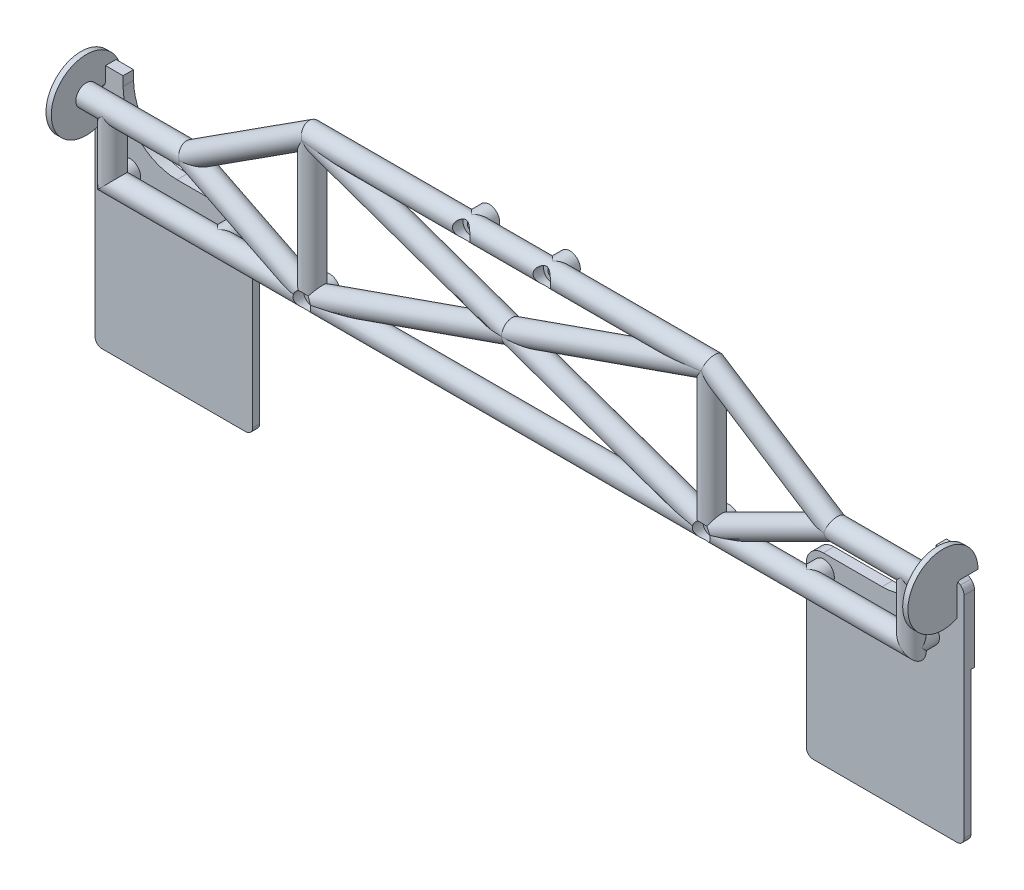
from build123d import *

# Parameters (mm, degrees)
SWEEP1_PROFILE_R    = 3
SWEEP6_PROFILE_R    = 3
SWEEP7_PROFILE_R    = 3
SWEEP8_PROFILE_R    = 3
SWEEP9_PROFILE_R    = 3
SWEEP10_PROFILE_R   = 3
SWEEP11_PROFILE_R   = 3
SKETCH182_R         = 3
BOSS_EXTRUDE1_DEPTH = 5
SKETCH183_R         = 2.5
CUT_EXTRUDE1_DEPTH  = 5
SKETCH184_R         = 1.25
CUT_EXTRUDE2_DEPTH  = 124.91630281
BOSS_EXTRUDE2_DEPTH = 1.5
BOSS_EXTRUDE3_DEPTH = 3
CUT_EXTRUDE3_START  = -1
CUT_EXTRUDE3_DEPTH  = 1


with BuildPart() as part:
    # Sweep1: sweep along a path in Sketch1
    with BuildLine(Plane.XY) as sweep1_path:
        Line((121.5, -2.5), (92, -2.5))
        Line((92, -2.5), (57, 20))
        Line((57, 20), (-57, 20))
        Line((-57, 20), (-92, -2.5))
        Line((-92, -2.5), (-121.5, -2.5))
    # Sweep1 profile (on start of the path) → Sweep1 (sweep)
    with BuildSketch(Plane(origin=(121.5, -2.5, 0), x_dir=(0, -1, 0), z_dir=(-1, 0, 0))):
        Circle(SWEEP1_PROFILE_R)
    sweep(path=sweep1_path.line, transition=Transition.RIGHT)

    # Sweep6: sweep along a path in Sketch108
    with BuildLine(Plane.XY) as sweep6_path:
        Line((-121.5, -2.5), (-92, -2.5))
        Line((-92, -2.5), (-57, -20))
        Line((-57, -20), (57, -20))
        Line((57, -20), (92, -2.5))
        Line((92, -2.5), (121.5, -2.5))
    # Sweep6 profile (on start of the path) → Sweep6 (sweep)
    with BuildSketch(Plane(origin=(-121.5, -2.5, 0), x_dir=(0, 1, 0), z_dir=(1, 0, 0))):
        Circle(SWEEP6_PROFILE_R)
    sweep(path=sweep6_path.line, transition=Transition.RIGHT)

    # Sweep7: sweep along a path in Sketch121
    with BuildLine(Plane.XY) as sweep7_path:
        Line((-57, 20), (57, -20))
    # Sweep7 profile (on start of the path) → Sweep7 (sweep)
    with BuildSketch(Plane(origin=(-57, 20, 0), x_dir=(0.33108771302908074, 0.943599982132881, 0), z_dir=(0.943599982132881, -0.33108771302908074, 0))):
        Circle(SWEEP7_PROFILE_R)
    sweep(path=sweep7_path.line)

    # Sweep8: sweep along a path in Sketch130
    with BuildLine(Plane.XY) as sweep8_path:
        Line((-57, -20), (57, 20))
    # Sweep8 profile (on start of the path) → Sweep8 (sweep)
    with BuildSketch(Plane(origin=(-57, -20, 0), x_dir=(-0.33108771302908074, 0.943599982132881, 0), z_dir=(0.943599982132881, 0.33108771302908074, 0))):
        Circle(SWEEP8_PROFILE_R)
    sweep(path=sweep8_path.line)

    # Sweep9: sweep along a path in Sketch143
    with BuildLine(Plane.XY) as sweep9_path:
        Line((-57, 20), (-57, -20))
    # Sweep9 profile (on start of the path) → Sweep9 (sweep)
    with BuildSketch(Plane(origin=(-57, 20, 0), x_dir=(-1, 0, 0), z_dir=(0, -1, 0))):
        Circle(SWEEP9_PROFILE_R)
    sweep(path=sweep9_path.line)

    # Sweep10: sweep along a path in Sketch152
    with BuildLine(Plane.XY) as sweep10_path:
        Line((57, 20), (57, -20))
    # Sweep10 profile (on start of the path) → Sweep10 (sweep)
    with BuildSketch(Plane(origin=(57, 20, 0), x_dir=(-1, 0, 0), z_dir=(0, -1, 0))):
        Circle(SWEEP10_PROFILE_R)
    sweep(path=sweep10_path.line)

    # Sweep11: sweep along a path in Sketch165
    with BuildLine(Plane.XY) as sweep11_path:
        Line((57, -20), (114, -20))
        Line((114, -20), (114, -2.5))
    # Sweep11 profile (on start of the path) → Sweep11 (sweep)
    with BuildSketch(Plane(origin=(57, -20, 0), x_dir=(0, 0, 1), z_dir=(1, 0, 0))):
        Circle(SWEEP11_PROFILE_R)
    sweep11 = sweep(path=sweep11_path.line, transition=Transition.RIGHT)

    # Mirror1: Sweep11 across plane
    add(sweep11.mirror(Plane(origin=(0, 0, 0), x_dir=(0, 0, 1), z_dir=(1, 0, 0))))

    # Sketch182 → Boss-Extrude1 (add)
    with BuildSketch(Plane.XY):
        with Locations((11.5, 20)):
            Circle(SKETCH182_R)
        with Locations((-11.5, 20)):
            Circle(SKETCH182_R)
        with Locations((57, -20)):
            Circle(SKETCH182_R)
        with Locations((-57, -20)):
            Circle(SKETCH182_R)
        with Locations((114, -20)):
            Circle(SKETCH182_R)
        with Locations((84, -20)):
            Circle(SKETCH182_R)
        with Locations((-114, -20)):
            Circle(SKETCH182_R)
        with Locations((-84, -20)):
            Circle(SKETCH182_R)
    extrude(amount=-BOSS_EXTRUDE1_DEPTH)

    # Sketch183 → Cut-Extrude1 (cut)
    with BuildSketch(Plane.XY):
        with Locations((11.5, 20)):
            Circle(SKETCH183_R)
        with Locations((-11.5, 20)):
            Circle(SKETCH183_R)
        with Locations((57, -20)):
            Circle(SKETCH183_R)
        with Locations((-57, -20)):
            Circle(SKETCH183_R)
    extrude(amount=CUT_EXTRUDE1_DEPTH, mode=Mode.SUBTRACT)

    # Sketch184 → Cut-Extrude2 (cut, through all)
    with BuildSketch(Plane(origin=(0, 0, -5), x_dir=(-1, 0, 0), z_dir=(0, 0, -1))):
        with Locations((-11.5, 20)):
            Circle(SKETCH184_R)
        with Locations((11.5, 20)):
            Circle(SKETCH184_R)
        with Locations((57, -20)):
            Circle(SKETCH184_R)
        with Locations((-57, -20)):
            Circle(SKETCH184_R)
    extrude(amount=-CUT_EXTRUDE2_DEPTH, mode=Mode.SUBTRACT)


with BuildPart() as body_2:
    # Sketch201 → Boss-Extrude2 (new body)
    with BuildSketch(Plane(origin=(121.5, 0, 0), x_dir=(0, 0, -1), z_dir=(1, 0, 0))):
        with BuildLine():
            Line((5, -2.5), (10, -2.5))
            ThreePointArc((10, -2.5), (-8.366600265, 2.977225575), (4, -11.66515139))
            Line((4, -11.66515139), (4, -3.5))
            ThreePointArc((4, -3.5), (4.292893219, -2.792893219), (5, -2.5))
        make_face()
    boss_extrude2 = extrude(amount=BOSS_EXTRUDE2_DEPTH)


with BuildPart() as part_1:
    add(part.part)

    # Mirror3: Boss-Extrude2 across plane
    add(boss_extrude2.mirror(Plane(origin=(0, 0, 0), x_dir=(0, 0, 1), z_dir=(1, 0, 0))))

    # Sketch202 → Boss-Extrude3 (add)
    with BuildSketch(Plane(origin=(0, 0, -5), x_dir=(-1, 0, 0), z_dir=(0, 0, -1))):
        with BuildLine():
            Line((124, -66), (124, -5.949801119))
            ThreePointArc((124, -5.949801119), (123.726828377, -4.813475734), (122.967011696, -3.925479829))
            Line((122.967011696, -3.925479829), (122.032988304, -3.248599509))
            ThreePointArc((122.032988304, -3.248599509), (121.273171623, -2.360603604), (121, -1.22427822))
            Line((121, -1.22427822), (121, 2.5))
            Line((121, 2.5), (116, 2.5))
            Line((116, 2.5), (116, -0.113132155))
            ThreePointArc((116, -0.113132155), (111.49329075, -10.99329075), (100.613132155, -15.5))
            Line((100.613132155, -15.5), (83.865044547, -15.5))
            ThreePointArc((83.865044547, -15.5), (80.424938557, -16.924938557), (79, -20.365044547))
            Line((79, -20.365044547), (79, -66))
            ThreePointArc((79, -66), (79.585786438, -67.414213562), (81, -68))
            Line((81, -68), (122, -68))
            ThreePointArc((122, -68), (123.414213562, -67.414213562), (124, -66))
        make_face()
    boss_extrude3 = extrude(amount=BOSS_EXTRUDE3_DEPTH)

    # Sketch203 → Cut-Extrude3 (cut)
    with BuildSketch(Plane(origin=(0, 0, -8), x_dir=(-1, 0, 0), z_dir=(0, 0, -1)).offset(CUT_EXTRUDE3_START)):
        with BuildLine():
            Line((121, -25.230089094), (83.865044547, -25.230089094))
            ThreePointArc((83.865044547, -25.230089094), (80.424938557, -23.805150537), (79, -20.365044547))
            Line((79, -20.365044547), (79, -66))
            ThreePointArc((79, -66), (79.585786438, -67.414213562), (81, -68))
            Line((81, -68), (122, -68))
            ThreePointArc((122, -68), (123.414213562, -67.414213562), (124, -66))
            Line((124, -66), (124, -25.230089094))
            Line((124, -25.230089094), (121, -25.230089094))
        make_face()
        with BuildLine():
            ThreePointArc((118.92124917, -18.229367756), (120.11303171, -18.92185241), (121, -17.8667847))
            Line((121, -17.8667847), (121, -7.302741225))
            ThreePointArc((121, -7.302741225), (120.883222449, -6.900834109), (120.569255121, -6.624083603))
            Line((120.569255121, -6.624083603), (118.956361132, -5.86534363))
            ThreePointArc((118.956361132, -5.86534363), (118.34906255, -5.851519509), (117.930721847, -6.291966705))
            ThreePointArc((117.930721847, -6.291966705), (114.551814806, -12.104380426), (109.309294213, -16.313554205))
            ThreePointArc((109.309294213, -16.313554205), (109.199987492, -16.904599952), (109.800646615, -16.882426732))
            ThreePointArc((109.800646615, -16.882426732), (114.764098104, -14.826028023), (118.92124917, -18.229367756))
        make_face()
    cut_extrude3 = extrude(amount=CUT_EXTRUDE3_DEPTH, mode=Mode.SUBTRACT)

    # Mirror4: Boss-Extrude3, Cut-Extrude3 across plane
    add(boss_extrude3.mirror(Plane(origin=(0, 0, 0), x_dir=(0, 0, 1), z_dir=(1, 0, 0))))
    add(cut_extrude3.mirror(Plane(origin=(0, 0, 0), x_dir=(0, 0, 1), z_dir=(1, 0, 0))), mode=Mode.SUBTRACT)


solid = Compound([body_2.part, part_1.part])
